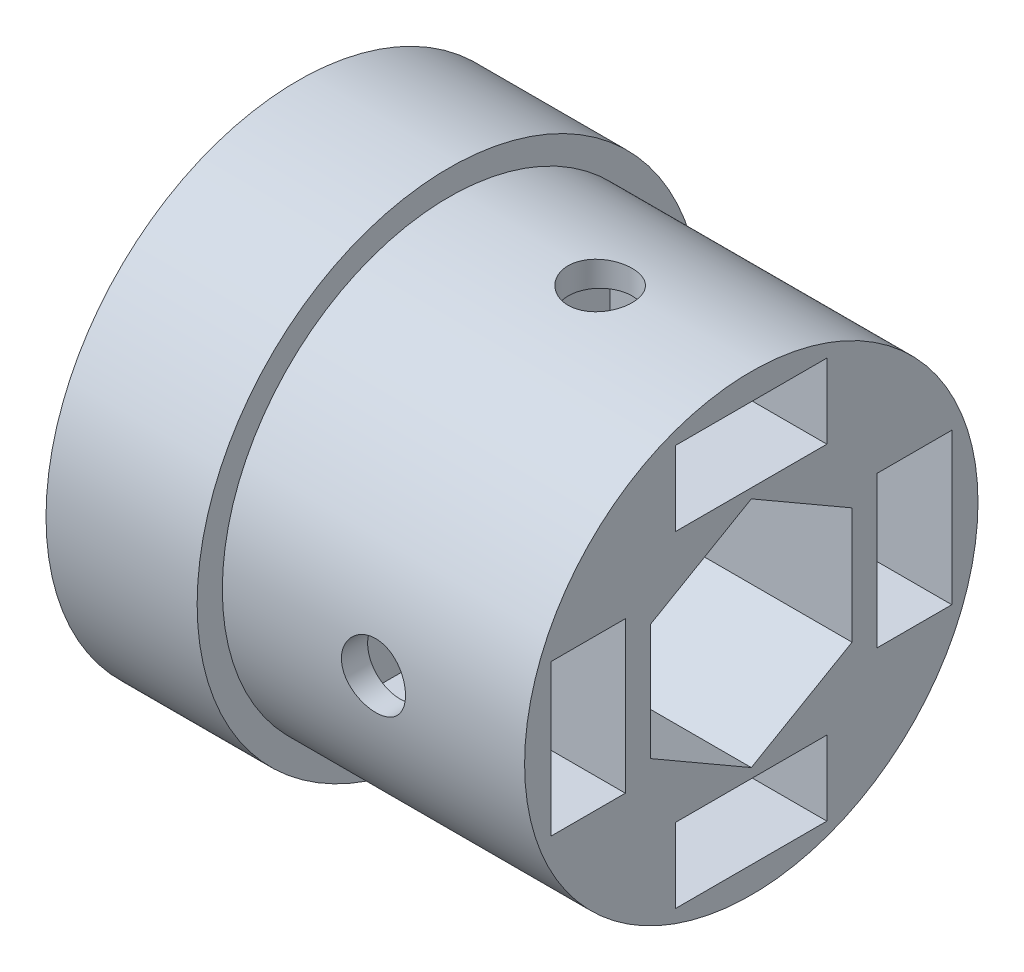
from build123d import *

# Parameters (mm, degrees)
SKETCH1_R               = 14.2875
BOSS_EXTRUDE1_DEPTH     = 19.05
SKETCH2_R               = 15.875
BOSS_EXTRUDE2_DEPTH     = 9.525
CUT_EXTRUDE1_DEPTH      = 37.339535977
CUT_EXTRUDE2_DEPTH      = 30.443738723
CUT_EXTRUDE2_DEPTH_BACK = 30.443738723
SKETCH5_R               = 2.0193
CUT_EXTRUDE3_DEPTH      = 30.443738788
CUT_EXTRUDE3_DEPTH_BACK = 30.443738788
SKETCH6_R               = 2.0193
CUT_EXTRUDE4_DEPTH      = 37.339535977
CUT_EXTRUDE4_DEPTH_BACK = 13.6525
SKETCH7_W               = 9.525
SKETCH7_H               = 4.699
SKETCH7_W_2             = 4.699
SKETCH7_H_2             = 9.525


with BuildPart() as part:
    # Sketch1 → Boss-Extrude1 (new body)
    with BuildSketch(Plane(origin=(0, 0, 0), x_dir=(0, 0, -1), z_dir=(1, 0, 0))):
        Circle(SKETCH1_R)
    extrude(amount=BOSS_EXTRUDE1_DEPTH)

    # Sketch2 → Boss-Extrude2 (add)
    with BuildSketch(Plane.ZY):
        Circle(SKETCH2_R)
    extrude(amount=BOSS_EXTRUDE2_DEPTH)

    # Sketch4 → Cut-Extrude1 (cut, through all)
    with BuildSketch(Plane.ZY.offset(9.525)):
        Polygon((0, 7.332348419), (-6.35, 3.666174209), (-6.35, -3.666174209), (0, -7.332348419), (6.35, -3.666174209), (6.35, 3.666174209), align=None)
    extrude(amount=-CUT_EXTRUDE1_DEPTH, mode=Mode.SUBTRACT)

    # Sketch5 → Cut-Extrude2 (cut, two sides: drawn at the far end of the back side and taken through both)
    with BuildSketch(Plane.XY.offset(-CUT_EXTRUDE2_DEPTH_BACK)):
        with Locations((9.525, 0)):
            Circle(SKETCH5_R)
    extrude(amount=CUT_EXTRUDE2_DEPTH + CUT_EXTRUDE2_DEPTH_BACK, mode=Mode.SUBTRACT)

    # Sketch6 → Cut-Extrude3 (cut, two sides: drawn at the far end of the back side and taken through both)
    with BuildSketch(Plane(origin=(0, 0, 0), x_dir=(1, 0, 0), z_dir=(0, 1, 0)).offset(-CUT_EXTRUDE3_DEPTH_BACK)):
        with Locations((9.525, 0)):
            Circle(SKETCH6_R)
    extrude(amount=CUT_EXTRUDE3_DEPTH + CUT_EXTRUDE3_DEPTH_BACK, mode=Mode.SUBTRACT)

    # Sketch7 → Cut-Extrude4 (cut, two sides: drawn at the far end of the back side and taken through both)
    with BuildSketch(Plane(origin=(19.05, 0, 0), x_dir=(0, 0, -1), z_dir=(1, 0, 0)).offset(-CUT_EXTRUDE4_DEPTH_BACK)):
        with Locations((0, -10.287)):
            Rectangle(SKETCH7_W, SKETCH7_H)
        with Locations((10.287, 0)):
            Rectangle(SKETCH7_W_2, SKETCH7_H_2)
        with Locations((-10.287, 0)):
            Rectangle(SKETCH7_W_2, SKETCH7_H_2)
        with Locations((0, 10.287)):
            Rectangle(SKETCH7_W, SKETCH7_H)
    extrude(amount=CUT_EXTRUDE4_DEPTH + CUT_EXTRUDE4_DEPTH_BACK, mode=Mode.SUBTRACT)


solid = part.part
